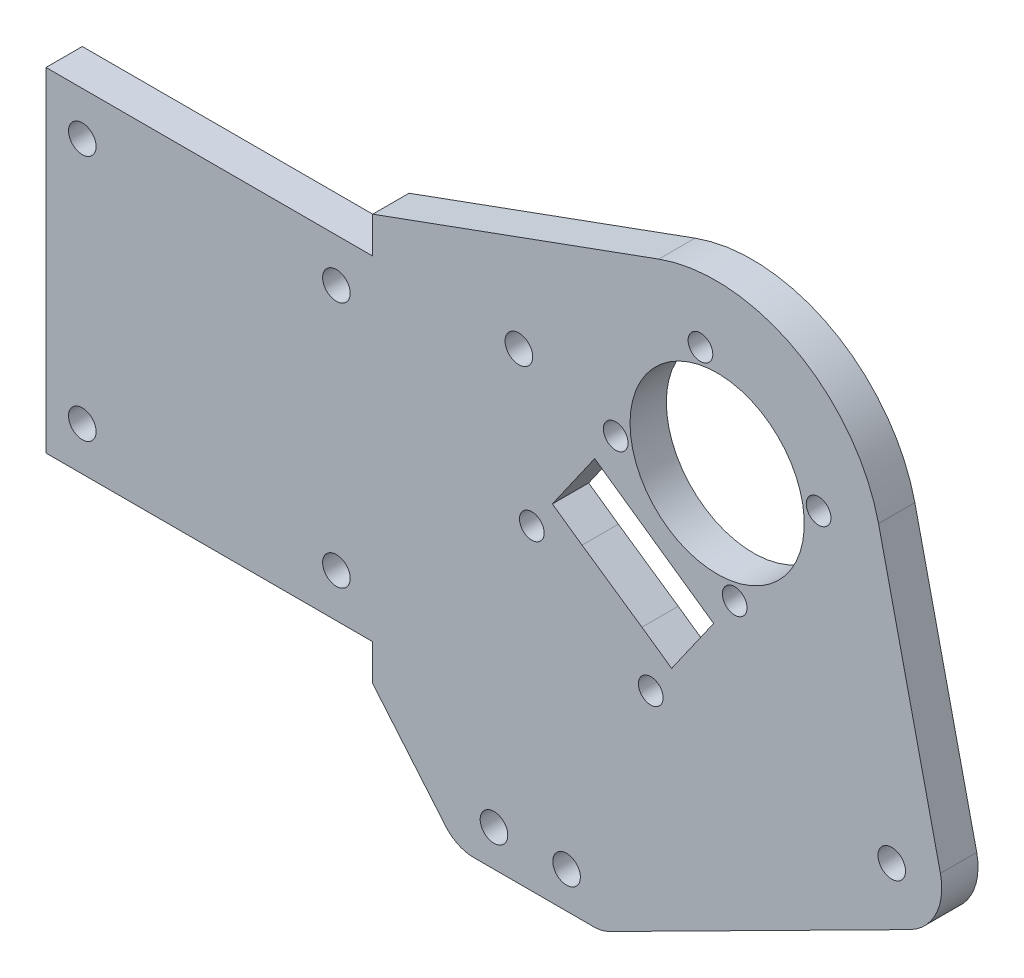
from build123d import *

# Parameters (mm, degrees)
ESQUISSE1_R         = 1.9
BOSS_EXTRU_1_DEPTH  = 5
EXTRUDE_1_DEPTH     = 5
EXTRUDE_2_DEPTH     = 5
SKETCH_6_R          = 1.6
CUT_EXTRUDE_2_DEPTH = 5
EXTRUDE_4_DEPTH     = 5
CUT_EXTRUDE_3_DEPTH = 5
EXTRUDE_6_DEPTH     = 5
SKETCH_10_R         = 12
CUT_EXTRUDE_4_DEPTH = 5
SKETCH_11_R         = 12.59581588
SKETCH_11_R_2       = 8.721789125
EXTRUDE_7_DEPTH     = 5
SKETCH_12_R         = 12
CUT_EXTRUDE_5_DEPTH = 5
SKETCH_13_R         = 3.051220473
SKETCH_13_R_2       = 0.885355671
SKETCH_13_R_3       = 2.495868873
SKETCH_13_R_4       = 0.973791961
EXTRUDE_8_DEPTH     = 5
SKETCH_14_R         = 1.6
SKETCH_14_R_2       = 12
CUT_EXTRUDE_6_DEPTH = 5
EXTRUDE_START       = -5
EXTRUDE_9_DEPTH     = 5
SKETCH_16_R         = 1.7
CUT_EXTRUDE_7_DEPTH = 5
SKETCH_17_W         = 35
SKETCH_17_H         = 46
EXTRUDE_10_DEPTH    = 5
SKETCH_18_R         = 1.9
CUT_EXTRUDE_8_DEPTH = 5


# Read off the part's stored shape, not the designer's step: 凸台-拉伸9
with BuildPart() as part:
    # Esquisse1 → Boss.-Extru.1 (new body)
    with BuildSketch(Plane.XY):
        with BuildLine():
            Line((40.548338426, -21.276277818), (-0.975727052, -42.264773686))
            ThreePointArc((-0.975727052, -42.264773686), (-2.030907408, -42.633295828), (-3.141586831, -42.758217285))
            Line((-3.141586831, -42.758217285), (-19.618188193, -42.758217285))
            ThreePointArc((-19.618188193, -42.758217285), (-21.685859542, -42.310660648), (-23.383370665, -41.048112535))
            Line((-23.383370665, -41.048112535), (-33.519906154, -28.967859949))
            Line((-33.519906154, -28.967859949), (-33.519906154, -23.969415955))
            Line((-33.519906154, -23.969415955), (-43.519906154, -23.969415955))
            Line((-43.519906154, -23.969415955), (-43.519906154, 22.030584045))
            Line((-43.519906154, 22.030584045), (-33.519906154, 22.030584045))
            Line((-33.519906154, 22.030584045), (-33.519906154, 27.030582734))
            Line((-33.519906154, 27.030582734), (5.8804708, 41.371147503))
            ThreePointArc((5.8804708, 41.371147503), (24.71028401, 39.977143129), (36.151646844, 24.957145453))
            Line((36.151646844, 24.957145453), (44.672795688, -12.50542283))
            ThreePointArc((44.672795688, -12.50542283), (44.089997655, -17.586546272), (40.548338426, -21.276277818))
        make_face()
        with Locations((37.968513549, -14.646168575)):
            Circle(ESQUISSE1_R, mode=Mode.SUBTRACT)
        with Locations((26.290921771, 28.768039745)):
            Circle(ESQUISSE1_R, mode=Mode.SUBTRACT)
        with Locations((18.099401328, 34.503804109)):
            Circle(ESQUISSE1_R, mode=Mode.SUBTRACT)
        with Locations((-1.81432361, -11.370410425)):
            Circle(ESQUISSE1_R, mode=Mode.SUBTRACT)
        with Locations((-10.005844053, -5.634646061)):
            Circle(ESQUISSE1_R, mode=Mode.SUBTRACT)
        with Locations((-13.38853652, 21.030583318)):
            Circle(ESQUISSE1_R, mode=Mode.SUBTRACT)
        with Locations((-6.818359545, -37.758216658)):
            Circle(ESQUISSE1_R, mode=Mode.SUBTRACT)
        with Locations((-16.818359545, -37.758216658)):
            Circle(ESQUISSE1_R, mode=Mode.SUBTRACT)
        with Locations((-38.519906154, -17.969415955)):
            Circle(ESQUISSE1_R, mode=Mode.SUBTRACT)
        with Locations((-38.519906154, 16.030584045)):
            Circle(ESQUISSE1_R, mode=Mode.SUBTRACT)
        with BuildLine():
            Line((21.617307412, 29.328732493), (24.05500749, 32.810128977))
            ThreePointArc((24.05500749, 32.810128977), (23.766600359, 33.932469516), (22.625252159, 33.732091761))
            Line((22.625252159, 33.732091761), (20.187552449, 30.250695803))
            ThreePointArc((20.187552449, 30.250695803), (18.892160946, 29.381199086), (17.366350313, 29.706722658))
            Line((17.366350313, 29.706722658), (11.508582376, 33.808377058))
            Line((11.508582376, 33.808377058), (-11.606548602, 0.796549047))
            Line((-11.606548602, 0.796549047), (-5.749613357, -3.304522496))
            ThreePointArc((-5.749613357, -3.304522496), (-4.927150936, -4.595530225), (-5.258462389, -6.089979325))
            Line((-5.258462389, -6.089979325), (-7.696162511, -9.571375872))
            ThreePointArc((-7.696162511, -9.571375872), (-7.487422906, -10.755197269), (-6.303601509, -10.546457664))
            Line((-6.303601509, -10.546457664), (-3.865901833, -7.065061754))
            ThreePointArc((-3.865901833, -7.065061754), (-2.574894061, -6.242599111), (-1.080444801, -6.573910562))
            Line((-1.080444801, -6.573910562), (4.776491193, -10.67498149))
            Line((4.776491193, -10.67498149), (27.891620971, 22.336844808))
            Line((27.891620971, 22.336844808), (22.031293977, 26.440291454))
            ThreePointArc((22.031293977, 26.440291454), (21.198678089, 27.79484445), (21.617307412, 29.328732493))
        make_face(mode=Mode.SUBTRACT)
    extrude(amount=BOSS_EXTRU_1_DEPTH)

    # 草图3 → 凸台-拉伸1 (add)
    with BuildSketch(Plane.XY.offset(5)):
        Polygon((17.366350313, 29.706722658), (22.031293977, 26.440291454), (27.521539946, 34.281169324), (22.856520703, 37.547606144), align=None)
    extrude(amount=-EXTRUDE_1_DEPTH)

    # 草图4 → 凸台-拉伸2 (add)
    with BuildSketch(Plane.XY.offset(5)):
        Polygon((-5.749613357, -3.304522496), (-1.080444801, -6.573910562), (-5.905310476, -13.464530652), (-10.574479032, -10.195142586), align=None)
    extrude(amount=-EXTRUDE_2_DEPTH)

    # 草图6 → 切除-拉伸2 (cut)
    with BuildSketch(Plane.XY):
        with Locations((11.618629634, 33.731321117)):
            Circle(SKETCH_6_R)
        with Locations((27.891620971, 22.336844808)):
            Circle(SKETCH_6_R)
        with Locations((-11.606548602, 0.796549047)):
            Circle(SKETCH_6_R)
        with Locations((4.776491193, -10.67498149)):
            Circle(SKETCH_6_R)
        with Locations((16.334056082, 5.830931659)):
            Circle(SKETCH_6_R)
        with Locations((-0.048983113, 17.302463052)):
            Circle(SKETCH_6_R)
    extrude(amount=CUT_EXTRUDE_2_DEPTH, mode=Mode.SUBTRACT)

    # 草图7 → 凸台-拉伸4 (add)
    with BuildSketch(Plane(origin=(0, 0, 0), x_dir=(-1, 0, 0), z_dir=(0, 0, -1))):
        Polygon((-27.348574266, 25.536925262), (-13.960830243, 33.567092121), (-17.290103765, 39.11759468), (-30.677847788, 31.087427821), align=None)
        Polygon((-1.835596657, -11.454822901), (11.156296117, -1.885351923), (15.083921052, -7.217651078), (2.092028278, -16.787122056), align=None)
    extrude(amount=-EXTRUDE_4_DEPTH)

    # 草图8 → 切除-拉伸3 (cut)
    with BuildSketch(Plane(origin=(0, 0, 0), x_dir=(-1, 0, 0), z_dir=(0, 0, -1))):
        with BuildLine():
            ThreePointArc((-19.485360525, 10.331460788), (-15.741376215, 8.971828118), (-11.75865467, 9.034666013))
            Line((-11.75865467, 9.034666013), (-4.525140456, 14.099627228))
            ThreePointArc((-4.525140456, 14.099627228), (-3.329387761, 16.849491145), (-2.920679758, 19.820102839))
            ThreePointArc((-2.920679758, 19.820102839), (-2.965693001, 20.8142181), (-3.100364331, 21.800197297))
            Line((-3.100364331, 21.800197297), (-8.359233833, 29.310641244))
            ThreePointArc((-8.359233833, 29.310641244), (-12.101833808, 30.668687973), (-16.082707796, 30.605539073))
            Line((-16.082707796, 30.605539073), (-17.366350313, 29.706722658))
            Line((-17.366350313, 29.706722658), (-22.031293977, 26.440291454))
            Line((-22.031293977, 26.440291454), (-23.316220712, 25.540575737))
            ThreePointArc((-23.316220712, 25.540575737), (-24.737438626, 21.819534658), (-24.740319575, 17.836320031))
            Line((-24.740319575, 17.836320031), (-19.485360525, 10.331460788))
        make_face()
        with BuildLine():
            Line((-8.359233833, 29.310641244), (-3.100364331, 21.800197297))
            ThreePointArc((-3.100364331, 21.800197297), (-4.910007291, 26.129443667), (-8.359233833, 29.310641244))
        make_face()
        with BuildLine():
            ThreePointArc((-16.082707796, 30.605539073), (-20.230023119, 28.830773532), (-23.316220712, 25.540575737))
            Line((-23.316220712, 25.540575737), (-22.031293977, 26.440291454))
            Line((-22.031293977, 26.440291454), (-17.366350313, 29.706722658))
            Line((-17.366350313, 29.706722658), (-16.082707796, 30.605539073))
        make_face()
        with BuildLine():
            ThreePointArc((-24.740319575, 17.836320031), (-22.931352225, 13.510762011), (-19.485360525, 10.331460788))
            Line((-19.485360525, 10.331460788), (-24.740319575, 17.836320031))
        make_face()
    extrude(amount=-CUT_EXTRUDE_3_DEPTH, mode=Mode.SUBTRACT)

    # 草图9 → 凸台-拉伸6 (add)
    with BuildSketch(Plane(origin=(0, 0, 0), x_dir=(-1, 0, 0), z_dir=(0, 0, -1))):
        with BuildLine():
            ThreePointArc((-25.974969527, 19.599582888), (-25.771002401, 21.991557628), (-25.094991232, 24.295066831))
            Line((-25.094991269, 24.295066884), (-26.580977893, 23.254567382))
            ThreePointArc((-26.580977858, 23.254567332), (-26.365673891, 22.817974219), (-26.291620971, 22.336844808))
            ThreePointArc((-26.291620971, 22.336844808), (-26.472403636, 21.598047029), (-26.973898668, 21.02620154))
            Line((-26.973898668, 21.02620154), (-25.974969527, 19.599582888))
        make_face()
        with BuildLine():
            ThreePointArc((-11.976590293, 31.613327776), (-10.804649732, 31.354387066), (-9.664437004, 30.979673968))
            Line((-9.664437004, 30.979673968), (-10.692189677, 32.426825426))
            ThreePointArc((-10.692189677, 32.426825426), (-11.261577481, 32.17166931), (-11.885263309, 32.153694265))
            Line((-11.885263309, 32.153694265), (-11.976590293, 31.613327776))
        make_face()
        with BuildLine():
            ThreePointArc((-14.41526284, 31.773096587), (-13.191848686, 31.755455968), (-11.976590293, 31.613327776))
            Line((-11.976590293, 31.613327776), (-11.885263309, 32.153694265))
            ThreePointArc((-11.885263309, 32.153694265), (-12.4735091, 32.3788489), (-12.929272711, 32.813598543))
            Line((-12.929272711, 32.813598543), (-14.41526284, 31.773096587))
        make_face()
        with BuildLine():
            ThreePointArc((-1.261660013, 16.384740548), (-1.527626733, 17.575045871), (-0.877456843, 18.606958743))
            Line((-0.877456843, 18.606958743), (-1.982414842, 20.162820986))
            ThreePointArc((-1.982414842, 20.162820986), (-1.97786095, 19.971997834), (-1.976342858, 19.781126388))
            ThreePointArc((-1.976342858, 19.781126388), (-2.198741813, 17.481536505), (-2.85769513, 15.267184353))
            Line((-2.85769513, 15.267184353), (-1.261660013, 16.384740548))
        make_face()
        with BuildLine():
            Line((-16.067422406, 7.408558511), (-15.976095422, 7.948925))
            ThreePointArc((-15.976095422, 7.948925), (-17.128646557, 8.202569423), (-18.250709888, 8.568196954))
            Line((-18.250709888, 8.568196954), (-17.251778384, 7.141574927))
            ThreePointArc((-17.251778384, 7.141574927), (-16.685907128, 7.39176504), (-16.067422406, 7.408558511))
        make_face()
        with BuildLine():
            Line((-15.023412956, 6.748654164), (-13.537422544, 7.789156201))
            ThreePointArc((-13.537422544, 7.789156201), (-14.760836864, 7.806796797), (-15.976095422, 7.948925))
            Line((-15.976095422, 7.948925), (-16.067422406, 7.408558511))
            ThreePointArc((-16.067422406, 7.408558511), (-15.479176579, 7.183403853), (-15.023412956, 6.748654164))
        make_face()
    extrude(amount=-EXTRUDE_6_DEPTH)


with BuildPart() as extrude_6_piece_1:
    # of the separate pieces the step leaves, piece 1, a body of its own (extrude_6_pieces)
    add(part.part.solids().sort_by_distance((40.548338426, -21.276277818, 0))[0])


with BuildPart() as extrude_6_piece_2:
    # of the separate pieces the step leaves, piece 2, a body of its own (extrude_6_pieces)
    add(part.part.solids().sort_by_distance((2.85769513, 15.267184353, 0))[0])


with BuildPart() as cut_extrude_4_tool:
    # 草图10 → 切除-拉伸4 (new body)
    with BuildSketch(Plane(origin=(0, 0, 0), x_dir=(-1, 0, 0), z_dir=(0, 0, -1))):
        with Locations((-13.920679758, 19.820102839)):
            Circle(SKETCH_10_R)
    extrude(amount=-CUT_EXTRUDE_4_DEPTH)


with BuildPart() as extrude_6_piece_1_1:
    add(extrude_6_piece_1.part)

    # 切除-拉伸4: cut by cut_extrude_4_tool
    add(cut_extrude_4_tool.part, mode=Mode.SUBTRACT)



with BuildPart() as extrude_6_piece_2_1:
    add(extrude_6_piece_2.part)

    # 切除-拉伸4: cut by cut_extrude_4_tool
    add(cut_extrude_4_tool.part, mode=Mode.SUBTRACT)


with BuildPart() as extrude_6_piece_1_2:
    add(extrude_6_piece_1_1.part)

    add(extrude_6_piece_2_1.part)  # 凸台-拉伸7 merges 凸台-拉伸6 piece 2
    # 草图11 → 凸台-拉伸7 (add)
    with BuildSketch(Plane(origin=(0, 0, 0), x_dir=(-1, 0, 0), z_dir=(0, 0, -1))):
        with Locations((-13.920679758, 19.820102839)):
            Circle(SKETCH_11_R)
        with Locations((-13.920679758, 19.820102839)):
            Circle(SKETCH_11_R_2, mode=Mode.SUBTRACT)
    extrude(amount=-EXTRUDE_7_DEPTH)

    # 草图12 → 切除-拉伸5 (cut)
    with BuildSketch(Plane(origin=(0, 0, 0), x_dir=(-1, 0, 0), z_dir=(0, 0, -1))):
        with Locations((-13.920679758, 19.820102839)):
            Circle(SKETCH_12_R)
    extrude(amount=-CUT_EXTRUDE_5_DEPTH, mode=Mode.SUBTRACT)

    # 草图13 → 凸台-拉伸8 (add)
    # profile 1 of 2: a face of its own
    with BuildSketch(Plane(origin=(0, 0, 0), x_dir=(-1, 0, 0), z_dir=(0, 0, -1))):
        with Locations((-11.618629634, 33.731321117)):
            Circle(SKETCH_13_R)
        with Locations((-11.618629634, 33.731321117)):
            Circle(SKETCH_13_R_2, mode=Mode.SUBTRACT)
    # profile 2 of 2: a face of its own
    with BuildSketch(Plane(origin=(0, 0, 0), x_dir=(-1, 0, 0), z_dir=(0, 0, -1))):
        with Locations((0.048983113, 17.302463052)):
            Circle(SKETCH_13_R_3)
        with Locations((0.048983113, 17.302463052)):
            Circle(SKETCH_13_R_4, mode=Mode.SUBTRACT)
    extrude(amount=-EXTRUDE_8_DEPTH)

    # 草图14 → 切除-拉伸6 (cut)
    with BuildSketch(Plane(origin=(0, 0, 0), x_dir=(-1, 0, 0), z_dir=(0, 0, -1))):
        with Locations((-11.618629634, 33.731321117)):
            Circle(SKETCH_14_R)
        with Locations((0.048983113, 17.302463052)):
            Circle(SKETCH_14_R)
        with Locations((-13.920679758, 19.820102839)):
            Circle(SKETCH_14_R_2)
    extrude(amount=-CUT_EXTRUDE_6_DEPTH, mode=Mode.SUBTRACT)

    # 凸台-拉伸9 outline → 凸台-拉伸9 (add)
    with BuildSketch(Plane(origin=(0, 0, 0), x_dir=(-1, 0, 0), z_dir=(0, 0, -1)).offset(EXTRUDE_START)):
        with BuildLine():
            ThreePointArc((-5.694213495, -9.364338222), (-4.498653765, -9.099289146), (-3.465847518, -9.757259768))
            Line((-3.465847518, -9.757259768), (10.295905471, -0.121173451))
            ThreePointArc((10.295905471, -0.121173451), (10.030856176, 1.074386008), (10.688826299, 2.107192315))
            Line((10.688826299, 2.107192315), (8.778837554, 4.834938915))
            Line((8.778837554, 4.834938915), (4.683080137, 1.967056791))
            Line((4.683080137, 1.967056791), (-3.557784811, -3.698236488))
            Line((-3.557784811, -3.698236488), (-7.653546083, -6.566121311))
            Line((-7.653546083, -6.566121311), (-5.694213495, -9.364338222))
        make_face()
        with BuildLine():
            Line((-15.416333779, 4.520288391), (-13.432329414, 1.68683653))
            Line((-13.432329414, 1.68683653), (2.950709781, 13.158367923))
            Line((2.950709781, 13.158367923), (1.480554693, 15.257966967))
            ThreePointArc((1.480554693, 15.257966967), (-0.363835187, 14.84097113), (-1.971266959, 15.836874066))
            ThreePointArc((-1.971266959, 15.836874066), (-6.72465494, 9.482220826), (-14.334431516, 7.231084324))
            Line((-14.334431516, 7.231084324), (-15.023412956, 6.748654164))
            ThreePointArc((-15.023412956, 6.748654164), (-14.758363655, 5.553094702), (-15.416333779, 4.520288391))
        make_face()
    extrude(amount=EXTRUDE_9_DEPTH)

    # 草图16 → 切除-拉伸7 (cut)
    with BuildSketch(Plane(origin=(0, 0, 0), x_dir=(-1, 0, 0), z_dir=(0, 0, -1))):
        with Locations((-16.334056082, 5.830931659)):
            Circle(SKETCH_16_R)
        with Locations((-4.776491193, -10.67498149)):
            Circle(SKETCH_16_R)
        with Locations((11.606548602, 0.796549047)):
            Circle(SKETCH_16_R)
        with Locations((-11.618629634, 33.731321117)):
            Circle(SKETCH_16_R)
        with Locations((0.048983113, 17.302463052)):
            Circle(SKETCH_16_R)
        with Locations((-27.891620971, 22.336844808)):
            Circle(SKETCH_16_R)
    extrude(amount=-CUT_EXTRUDE_7_DEPTH, mode=Mode.SUBTRACT)

    # 草图17 → 凸台-拉伸10 (add)
    with BuildSketch(Plane(origin=(0, 0, 0), x_dir=(-1, 0, 0), z_dir=(0, 0, -1))):
        with Locations((61.019906154, -0.969415955)):
            Rectangle(SKETCH_17_W, SKETCH_17_H)
    extrude(amount=-EXTRUDE_10_DEPTH)

    # 草图18 → 切除-拉伸8 (cut)
    with BuildSketch(Plane(origin=(0, 0, 0), x_dir=(-1, 0, 0), z_dir=(0, 0, -1))):
        with Locations((73.519906154, 16.030584045)):
            Circle(SKETCH_18_R)
        with Locations((73.519906154, -17.969415955)):
            Circle(SKETCH_18_R)
    extrude(amount=-CUT_EXTRUDE_8_DEPTH, mode=Mode.SUBTRACT)


solid = extrude_6_piece_1_2.part
